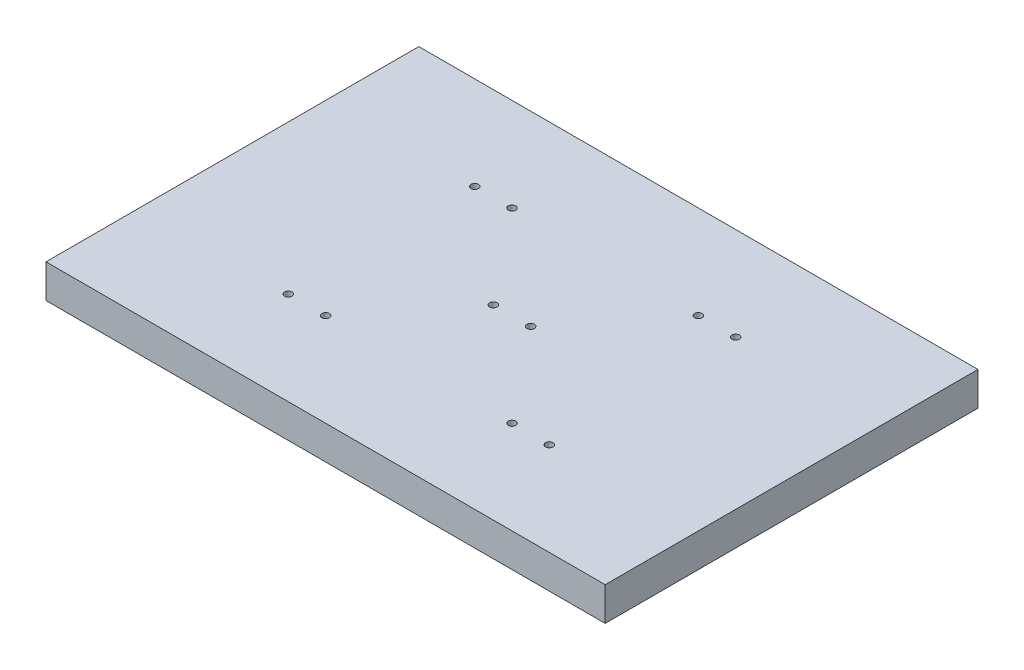
from build123d import *

# Parameters (mm, degrees)
SKETCH1_W           = 300
SKETCH1_H           = 200
SKETCH1_R           = 2
BOSS_EXTRUDE1_DEPTH = 18


with BuildPart() as part:
    # Sketch1 → Boss-Extrude1 (new body)
    with BuildSketch(Plane(origin=(0, 0, 0), x_dir=(1, 0, 0), z_dir=(0, 1, 0))):
        Rectangle(SKETCH1_W, SKETCH1_H)
        with Locations((10, 0)):
            Circle(SKETCH1_R, mode=Mode.SUBTRACT)
        with Locations((-10, 0)):
            Circle(SKETCH1_R, mode=Mode.SUBTRACT)
        with Locations((70, 50)):
            Circle(SKETCH1_R, mode=Mode.SUBTRACT)
        with Locations((50, 50)):
            Circle(SKETCH1_R, mode=Mode.SUBTRACT)
        with Locations((-70, 50)):
            Circle(SKETCH1_R, mode=Mode.SUBTRACT)
        with Locations((-50, 50)):
            Circle(SKETCH1_R, mode=Mode.SUBTRACT)
        with Locations((-50, -50)):
            Circle(SKETCH1_R, mode=Mode.SUBTRACT)
        with Locations((-70, -50)):
            Circle(SKETCH1_R, mode=Mode.SUBTRACT)
        with Locations((50, -50)):
            Circle(SKETCH1_R, mode=Mode.SUBTRACT)
        with Locations((70, -50)):
            Circle(SKETCH1_R, mode=Mode.SUBTRACT)
    extrude(amount=BOSS_EXTRUDE1_DEPTH)


solid = part.part
